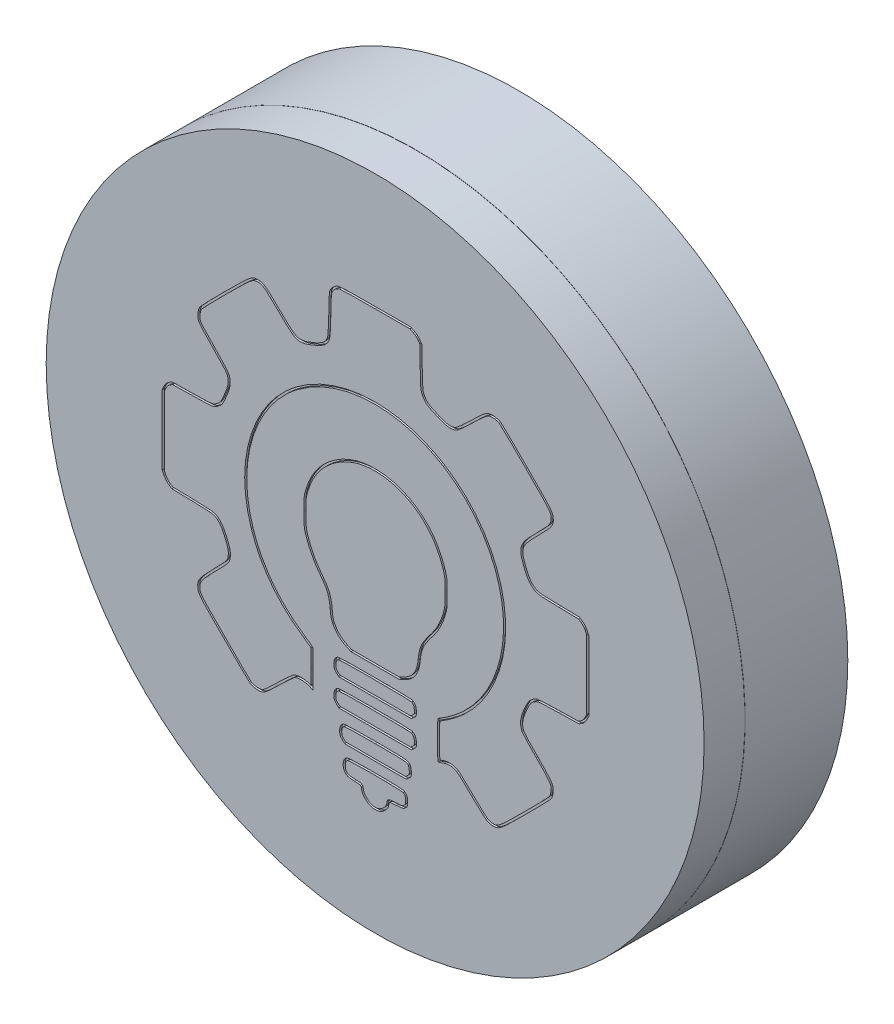
from build123d import *

# Parameters (mm, degrees)
SKETCH1_R           = 16.025
SKETCH1_R_2         = 15.025
BOSS_EXTRUDE1_DEPTH = 5
SKETCH2_R           = 16.025
BOSS_EXTRUDE3_DEPTH = 2
CUT_EXTRUDE1_DEPTH  = 0.1
SKETCH6_R           = 16.025
SKETCH6_R_2         = 16.015
CUT_EXTRUDE3_DEPTH  = 0.01


with BuildPart() as part:
    # Sketch1 → Boss-Extrude1 (new body)
    with BuildSketch(Plane.XY):
        Circle(SKETCH1_R)
        Circle(SKETCH1_R_2, mode=Mode.SUBTRACT)
    extrude(amount=BOSS_EXTRUDE1_DEPTH)

    # Sketch2 → Boss-Extrude3 (add)
    with BuildSketch(Plane.XY.offset(5)):
        Circle(SKETCH2_R)
    extrude(amount=BOSS_EXTRUDE3_DEPTH)

    # Sketch4 → Cut-Extrude1 (cut)
    # profile 1 of 6: a face of its own
    with BuildSketch(Plane.XY.offset(7)):
        with BuildLine():
            Line((-8.9288112, 2.310141401), (-9.9024785, 2.292502501))
            Line((-9.9024785, 2.292502501), (-10.0506452, 2.193724701))
            add(Edge.make_bspline(
                [(-10.0506452, 2.193724701), (-10.1529508, 2.123169101), (-10.2270342, 2.038502301), (-10.2870065, 1.911502301)],
                knots=[0, 0, 0, 0, 1, 1, 1, 1], degree=3))
            Line((-10.2870065, 1.911502301), (-10.3716732, 1.728057701))
            Line((-10.3716732, 1.728057701), (-10.3716732, 0.031195501))
            Line((-10.3716732, 0.031195501), (-10.3716732, -1.662138899))
            Line((-10.3716732, -1.662138899), (-10.2834787, -1.842055699))
            add(Edge.make_bspline(
                [(-10.2834787, -1.842055699), (-10.2270342, -1.954944599), (-10.1388397, -2.060777999), (-10.0471174, -2.120750299)],
                knots=[0, 0, 0, 0, 1, 1, 1, 1], degree=3))
            Line((-10.0471174, -2.120750299), (-9.9024785, -2.223055899))
            Line((-9.9024785, -2.223055899), (-8.9288112, -2.240694799))
            add(Edge.make_bspline(
                [(-8.9288112, -2.240694799), (-7.8281438, -2.261861499), (-7.792866, -2.268916999), (-7.5706159, -2.526444999)],
                knots=[0, 0, 0, 0, 1, 1, 1, 1], degree=3))
            add(Edge.make_bspline(
                [(-7.5706159, -2.526444999), (-7.4295047, -2.692250599), (-7.2107823, -3.172028699), (-7.1649212, -3.429556699)],
                knots=[0, 0, 0, 0, 1, 1, 1, 1], degree=3))
            add(Edge.make_bspline(
                [(-7.1649212, -3.429556699), (-7.1472823, -3.517751199), (-7.1508101, -3.651806799), (-7.168449, -3.750584599)],
                knots=[0, 0, 0, 0, 1, 1, 1, 1], degree=3))
            add(Edge.make_bspline(
                [(-7.168449, -3.750584599), (-7.2037268, -3.902279199), (-7.2566435, -3.969306999), (-7.8528383, -4.569029599)],
                knots=[0, 0, 0, 0, 1, 1, 1, 1], degree=3))
            add(Edge.make_bspline(
                [(-7.8528383, -4.569029599), (-8.5195887, -5.242835599), (-8.6395332, -5.412168999), (-8.643061, -5.659113599)],
                knots=[0, 0, 0, 0, 1, 1, 1, 1], degree=3))
            add(Edge.make_bspline(
                [(-8.643061, -5.659113599), (-8.643061, -5.980141599), (-8.6289499, -5.997780499), (-7.376588, -7.260725699)],
                knots=[0, 0, 0, 0, 1, 1, 1, 1], degree=3))
            add(Edge.make_bspline(
                [(-7.376588, -7.260725699), (-6.7239487, -7.916892799), (-6.141865, -8.484865399), (-6.0783649, -8.523670999)],
                knots=[0, 0, 0, 0, 1, 1, 1, 1], degree=3))
            add(Edge.make_bspline(
                [(-6.0783649, -8.523670999), (-5.9301982, -8.615393299), (-5.6550313, -8.647143299), (-5.4821701, -8.590698799)],
                knots=[0, 0, 0, 0, 1, 1, 1, 1], degree=3))
            add(Edge.make_bspline(
                [(-5.4821701, -8.590698799), (-5.3798645, -8.558948799), (-5.178781, -8.382559799), (-4.6919474, -7.902781699)],
                knots=[0, 0, 0, 0, 1, 1, 1, 1], degree=3))
            add(Edge.make_bspline(
                [(-4.6919474, -7.902781699), (-4.3321138, -7.550003699), (-3.9828636, -7.228975699), (-3.9158358, -7.193697899)],
                knots=[0, 0, 0, 0, 1, 1, 1, 1], degree=3))
            add(Edge.make_bspline(
                [(-3.9158358, -7.193697899), (-3.7429746, -7.101975599), (-3.414891, -7.109031199), (-3.1996965, -7.204281299)],
                knots=[0, 0, 0, 0, 1, 1, 1, 1], degree=3))
            Line((-3.1996965, -7.204281299), (-3.0338908, -7.281892399))
            Line((-3.0338908, -7.281892399), (-3.0338908, -6.399947399))
            add(Edge.make_bspline(
                [(-3.0338908, -6.399947399), (-3.0338908, -5.916641599), (-3.030363, -5.510946899), (-3.0268352, -5.493307999)],
                knots=[0, 0, 0, 0, 1, 1, 1, 1], degree=3))
            add(Edge.make_bspline(
                [(-3.0268352, -5.493307999), (-3.0268352, -5.479196799), (-3.206752, -5.345141199), (-3.4325299, -5.193446699)],
                knots=[0, 0, 0, 0, 1, 1, 1, 1], degree=3))
            add(Edge.make_bspline(
                [(-3.4325299, -5.193446699), (-4.6566696, -4.375001699), (-5.4892257, -3.288445499), (-5.9407815, -1.919666799)],
                knots=[0, 0, 0, 0, 1, 1, 1, 1], degree=3))
            add(Edge.make_bspline(
                [(-5.9407815, -1.919666799), (-6.7803932, 0.609751401), (-5.8984482, 3.431975401), (-3.7711968, 5.033587601)],
                knots=[0, 0, 0, 0, 1, 1, 1, 1], degree=3))
            add(Edge.make_bspline(
                [(-3.7711968, 5.033587601), (-1.6898066, 6.596394101), (1.1183063, 6.716338601), (3.3337521, 5.333448901)],
                knots=[0, 0, 0, 0, 1, 1, 1, 1], degree=3))
            add(Edge.make_bspline(
                [(3.3337521, 5.333448901), (5.7502814, 3.827086801), (6.8403654, 0.810834901), (5.9443093, -1.905555699)],
                knots=[0, 0, 0, 0, 1, 1, 1, 1], degree=3))
            add(Edge.make_bspline(
                [(5.9443093, -1.905555699), (5.5033368, -3.253167699), (4.649614, -4.378529499), (3.4713355, -5.168752199)],
                knots=[0, 0, 0, 0, 1, 1, 1, 1], degree=3))
            add(Edge.make_bspline(
                [(3.4713355, -5.168752199), (3.2737798, -5.299280099), (3.0973908, -5.412168999), (3.0726964, -5.419224599)],
                knots=[0, 0, 0, 0, 1, 1, 1, 1], degree=3))
            add(Edge.make_bspline(
                [(3.0726964, -5.419224599), (3.0091963, -5.440391299), (3.0127241, -7.271309099), (3.0762242, -7.260725699)],
                knots=[0, 0, 0, 0, 1, 1, 1, 1], degree=3))
            add(Edge.make_bspline(
                [(3.0762242, -7.260725699), (3.1009186, -7.257197999), (3.2173354, -7.218392399), (3.3337521, -7.179586799)],
                knots=[0, 0, 0, 0, 1, 1, 1, 1], degree=3))
            add(Edge.make_bspline(
                [(3.3337521, -7.179586799), (3.5630578, -7.094920099), (3.7711968, -7.105503399), (3.9687525, -7.204281299)],
                knots=[0, 0, 0, 0, 1, 1, 1, 1], degree=3))
            add(Edge.make_bspline(
                [(3.9687525, -7.204281299), (4.025197, -7.236031299), (4.3603361, -7.542948099), (4.7095863, -7.888670599)],
                knots=[0, 0, 0, 0, 1, 1, 1, 1], degree=3))
            add(Edge.make_bspline(
                [(4.7095863, -7.888670599), (5.3516423, -8.523670999), (5.4927535, -8.625976599), (5.7185314, -8.625976599)],
                knots=[0, 0, 0, 0, 1, 1, 1, 1], degree=3))
            add(Edge.make_bspline(
                [(5.7185314, -8.625976599), (6.0325038, -8.625976599), (6.0571983, -8.608337699), (7.3130879, -7.359503599)],
                knots=[0, 0, 0, 0, 1, 1, 1, 1], degree=3))
            add(Edge.make_bspline(
                [(7.3130879, -7.359503599), (7.969255, -6.706864299), (8.5372276, -6.124780599), (8.5760332, -6.061280499)],
                knots=[0, 0, 0, 0, 1, 1, 1, 1], degree=3))
            add(Edge.make_bspline(
                [(8.5760332, -6.061280499), (8.6148388, -6.001308299), (8.6536443, -5.870780399), (8.6677555, -5.772002599)],
                knots=[0, 0, 0, 0, 1, 1, 1, 1], degree=3))
            add(Edge.make_bspline(
                [(8.6677555, -5.772002599), (8.706561, -5.443918999), (8.6360054, -5.338085599), (7.9269217, -4.625474099)],
                knots=[0, 0, 0, 0, 1, 1, 1, 1], degree=3))
            add(Edge.make_bspline(
                [(7.9269217, -4.625474099), (7.552977, -4.251529399), (7.2707546, -3.937556999), (7.2390046, -3.867001399)],
                knots=[0, 0, 0, 0, 1, 1, 1, 1], degree=3))
            add(Edge.make_bspline(
                [(7.2390046, -3.867001399), (7.1472823, -3.648278999), (7.1719767, -3.422501099), (7.3201435, -3.052084199)],
                knots=[0, 0, 0, 0, 1, 1, 1, 1], degree=3))
            add(Edge.make_bspline(
                [(7.3201435, -3.052084199), (7.5176992, -2.565250599), (7.6235326, -2.427667099), (7.9022272, -2.304194799)],
                knots=[0, 0, 0, 0, 1, 1, 1, 1], degree=3))
            add(Edge.make_bspline(
                [(7.9022272, -2.304194799), (7.9551439, -2.279500399), (8.3643664, -2.254805899), (8.964089, -2.244222599)],
                knots=[0, 0, 0, 0, 1, 1, 1, 1], degree=3))
            Line((8.964089, -2.244222599), (9.9377563, -2.223055899))
            Line((9.9377563, -2.223055899), (10.0788675, -2.127805799))
            add(Edge.make_bspline(
                [(10.0788675, -2.127805799), (10.1705897, -2.067833599), (10.2552565, -1.969055699), (10.3152287, -1.849111199)],
                knots=[0, 0, 0, 0, 1, 1, 1, 1], degree=3))
            Line((10.3152287, -1.849111199), (10.406951, -1.662138899))
            Line((10.406951, -1.662138899), (10.406951, 0.031195501))
            Line((10.406951, 0.031195501), (10.406951, 1.728057701))
            Line((10.406951, 1.728057701), (10.3222843, 1.911502301))
            add(Edge.make_bspline(
                [(10.3222843, 1.911502301), (10.262312, 2.038502301), (10.1882286, 2.123169101), (10.085923, 2.193724701)],
                knots=[0, 0, 0, 0, 1, 1, 1, 1], degree=3))
            Line((10.085923, 2.193724701), (9.9377563, 2.292502501))
            Line((9.9377563, 2.292502501), (8.964089, 2.310141401))
            add(Edge.make_bspline(
                [(8.964089, 2.310141401), (8.0468662, 2.327780301), (7.9833661, 2.334835901), (7.8422549, 2.405391501)],
                knots=[0, 0, 0, 0, 1, 1, 1, 1], degree=3))
            add(Edge.make_bspline(
                [(7.8422549, 2.405391501), (7.6305881, 2.518280401), (7.5071158, 2.691141601), (7.3413102, 3.103891901)],
                knots=[0, 0, 0, 0, 1, 1, 1, 1], degree=3))
            add(Edge.make_bspline(
                [(7.3413102, 3.103891901), (7.0696711, 3.788281201), (7.1155323, 3.915281301), (7.9551439, 4.744309601)],
                knots=[0, 0, 0, 0, 1, 1, 1, 1], degree=3))
            add(Edge.make_bspline(
                [(7.9551439, 4.744309601), (8.5583943, 5.340504401), (8.674811, 5.499254501), (8.6783388, 5.728560201)],
                knots=[0, 0, 0, 0, 1, 1, 1, 1], degree=3))
            add(Edge.make_bspline(
                [(8.6783388, 5.728560201), (8.6783388, 6.049588201), (8.6642277, 6.067227101), (7.4118658, 7.330172301)],
                knots=[0, 0, 0, 0, 1, 1, 1, 1], degree=3))
            add(Edge.make_bspline(
                [(7.4118658, 7.330172301), (6.7592265, 7.986339401), (6.1771428, 8.554312001), (6.1136427, 8.593117601)],
                knots=[0, 0, 0, 0, 1, 1, 1, 1], degree=3))
            add(Edge.make_bspline(
                [(6.1136427, 8.593117601), (6.0536705, 8.631923201), (5.9231426, 8.670728701), (5.8243648, 8.684839901)],
                knots=[0, 0, 0, 0, 1, 1, 1, 1], degree=3))
            add(Edge.make_bspline(
                [(5.8243648, 8.684839901), (5.4962812, 8.723645401), (5.3833923, 8.653089801), (4.6743085, 7.951061601)],
                knots=[0, 0, 0, 0, 1, 1, 1, 1], degree=3))
            add(Edge.make_bspline(
                [(4.6743085, 7.951061601), (4.2862527, 7.570061401), (3.9863914, 7.301950101), (3.9052525, 7.266672301)],
                knots=[0, 0, 0, 0, 1, 1, 1, 1], degree=3))
            add(Edge.make_bspline(
                [(3.9052525, 7.266672301), (3.6900579, 7.178477801), (3.5101411, 7.199644501), (3.0903353, 7.372505701)],
                knots=[0, 0, 0, 0, 1, 1, 1, 1], degree=3))
            add(Edge.make_bspline(
                [(3.0903353, 7.372505701), (2.6281961, 7.563005801), (2.501196, 7.651200301), (2.3953626, 7.873450501)],
                knots=[0, 0, 0, 0, 1, 1, 1, 1], degree=3))
            add(Edge.make_bspline(
                [(2.3953626, 7.873450501), (2.3142237, 8.035728301), (2.3106959, 8.085117301), (2.293057, 8.998812301)],
                knots=[0, 0, 0, 0, 1, 1, 1, 1], degree=3))
            Line((2.293057, 8.998812301), (2.2754181, 9.954840701))
            Line((2.2754181, 9.954840701), (2.180168, 10.095951901))
            add(Edge.make_bspline(
                [(2.180168, 10.095951901), (2.1201958, 10.187674101), (2.0214179, 10.272340901), (1.9014734, 10.332313101)],
                knots=[0, 0, 0, 0, 1, 1, 1, 1], degree=3))
            Line((1.9014734, 10.332313101), (1.7145011, 10.424035401))
            Line((1.7145011, 10.424035401), (0.0211667, 10.420507601))
            add(Edge.make_bspline(
                [(0.0211667, 10.420507601), (-1.0830285, 10.420507601), (-1.7145011, 10.406396501), (-1.7815289, 10.381702001)],
                knots=[0, 0, 0, 0, 1, 1, 1, 1], degree=3))
            add(Edge.make_bspline(
                [(-1.7815289, 10.381702001), (-1.9438068, 10.321729801), (-2.0672791, 10.222951901), (-2.1590014, 10.078313001)],
                knots=[0, 0, 0, 0, 1, 1, 1, 1], degree=3))
            add(Edge.make_bspline(
                [(-2.1590014, 10.078313001), (-2.2366125, 9.951312901), (-2.2401403, 9.912507301), (-2.2577792, 8.995284501)],
                knots=[0, 0, 0, 0, 1, 1, 1, 1], degree=3))
            add(Edge.make_bspline(
                [(-2.2577792, 8.995284501), (-2.2789459, 7.944006101), (-2.2895292, 7.891089401), (-2.5117794, 7.668839201)],
                knots=[0, 0, 0, 0, 1, 1, 1, 1], degree=3))
            add(Edge.make_bspline(
                [(-2.5117794, 7.668839201), (-2.6564183, 7.520672501), (-3.287891, 7.249033401), (-3.5383633, 7.220811201)],
                knots=[0, 0, 0, 0, 1, 1, 1, 1], degree=3))
            add(Edge.make_bspline(
                [(-3.5383633, 7.220811201), (-3.848808, 7.189061101), (-3.9581692, 7.263144501), (-4.6425585, 7.944006101)],
                knots=[0, 0, 0, 0, 1, 1, 1, 1], degree=3))
            add(Edge.make_bspline(
                [(-4.6425585, 7.944006101), (-5.2810867, 8.579006501), (-5.4398368, 8.691895401), (-5.6797258, 8.695423201)],
                knots=[0, 0, 0, 0, 1, 1, 1, 1], degree=3))
            add(Edge.make_bspline(
                [(-5.6797258, 8.695423201), (-6.0042816, 8.695423201), (-6.0148649, 8.688367601), (-7.2778101, 7.432478001)],
                knots=[0, 0, 0, 0, 1, 1, 1, 1], degree=3))
            add(Edge.make_bspline(
                [(-7.2778101, 7.432478001), (-7.9339772, 6.776310901), (-8.5019498, 6.194227201), (-8.5407554, 6.130727101)],
                knots=[0, 0, 0, 0, 1, 1, 1, 1], degree=3))
            add(Edge.make_bspline(
                [(-8.5407554, 6.130727101), (-8.6324777, 5.982560401), (-8.6642277, 5.707393501), (-8.6077832, 5.534532301)],
                knots=[0, 0, 0, 0, 1, 1, 1, 1], degree=3))
            add(Edge.make_bspline(
                [(-8.6077832, 5.534532301), (-8.5725054, 5.432226701), (-8.3925886, 5.224087701), (-7.8986994, 4.723142901)],
                knots=[0, 0, 0, 0, 1, 1, 1, 1], degree=3))
            add(Edge.make_bspline(
                [(-7.8986994, 4.723142901), (-7.1966712, 4.010531401), (-7.1613934, 3.957614701), (-7.1613934, 3.626003301)],
                knots=[0, 0, 0, 0, 1, 1, 1, 1], degree=3))
            add(Edge.make_bspline(
                [(-7.1613934, 3.626003301), (-7.1613934, 3.435503201), (-7.4189213, 2.782863901), (-7.5565048, 2.610002701)],
                knots=[0, 0, 0, 0, 1, 1, 1, 1], degree=3))
            add(Edge.make_bspline(
                [(-7.5565048, 2.610002701), (-7.616477, 2.542974901), (-7.729366, 2.447724801), (-7.8069771, 2.405391501)],
                knots=[0, 0, 0, 0, 1, 1, 1, 1], degree=3))
            add(Edge.make_bspline(
                [(-7.8069771, 2.405391501), (-7.9480883, 2.334835901), (-8.0115884, 2.327780301), (-8.9288112, 2.310141401)],
                knots=[0, 0, 0, 0, 1, 1, 1, 1], degree=3))
        make_face()
        with BuildLine():
            Line((-8.926999902, 2.210157744), (-9.871380494, 2.193049462))
            Line((-9.871380494, 2.193049462), (-9.994499236, 2.110970301))
            add(Edge.make_bspline(
                [(-9.994499236, 2.110970301), (-10.015972402, 2.096128416), (-10.058129542, 2.063359706), (-10.109608985, 2.010305558), (-10.154972216, 1.948920007), (-10.184115388, 1.895200747), (-10.196581657, 1.868801625)],
                knots=[0.002322855, 0.002322855, 0.002322855, 0.002322855, 0.251742141, 0.501161428, 0.750580714, 1, 1, 1, 1], degree=3))
            Line((-10.196581657, 1.868801625), (-10.2716732, 1.706094025))
            Line((-10.2716732, 1.706094025), (-10.2716732, 0.031195501))
            Line((-10.2716732, 0.031195501), (-10.2716732, -1.638947353))
            Line((-10.2716732, -1.638947353), (-10.194035997, -1.797334308))
            add(Edge.make_bspline(
                [(-10.194035997, -1.797334308), (-10.18150014, -1.822406), (-10.153346231, -1.870863391), (-10.102472256, -1.939044575), (-10.045879437, -1.997625998), (-10.010525725, -2.02519697), (-9.990862899, -2.038053438)],
                knots=[0, 0, 0, 0, 0.251389654, 0.502779308, 0.754168962, 1.005558616, 1.005558616, 1.005558616, 1.005558616], degree=3))
            Line((-9.990862899, -2.038053438), (-9.869875205, -2.123630131))
            Line((-9.869875205, -2.123630131), (-8.926999941, -2.140711142))
            add(Edge.make_bspline(
                [(-8.926999941, -2.140711142), (-8.862180746, -2.141957666), (-8.726909995, -2.144608165), (-8.501448284, -2.149717566), (-8.267017407, -2.157315144), (-8.055495061, -2.171596562), (-7.840447676, -2.202019618), (-7.652009029, -2.280468647), (-7.546256444, -2.40161365), (-7.494685221, -2.461370806)],
                knots=[-3.3757e-05, -3.3757e-05, -3.3757e-05, -3.3757e-05, 0.062489449, 0.125012655, 0.250059066, 0.375105477, 0.500151889, 0.750244711, 1.000337534, 1.000337534, 1.000337534, 1.000337534], degree=3))
            add(Edge.make_bspline(
                [(-7.494685221, -2.461370806), (-7.471782984, -2.488280924), (-7.432614325, -2.542212679), (-7.345707626, -2.684567473), (-7.238650158, -2.897169549), (-7.126186895, -3.178571763), (-7.081413169, -3.328672852), (-7.066651646, -3.411008399)],
                knots=[-0.000527359, -0.000527359, -0.000527359, -0.000527359, 0.124392901, 0.249313161, 0.499153681, 0.748994201, 0.998834721, 0.998834721, 0.998834721, 0.998834721], degree=3))
            add(Edge.make_bspline(
                [(-7.066651646, -3.411008399), (-7.061005167, -3.439556125), (-7.05438461, -3.496209784), (-7.052257588, -3.589646962), (-7.057609528, -3.684324327), (-7.065267769, -3.741628224), (-7.070461535, -3.770713298)],
                knots=[0.003225677, 0.003225677, 0.003225677, 0.003225677, 0.254570237, 0.505914798, 0.757259358, 1.008603918, 1.008603918, 1.008603918, 1.008603918], degree=3))
            add(Edge.make_bspline(
                [(-7.070461535, -3.770713298), (-7.080965153, -3.815878874), (-7.106104641, -3.898585742), (-7.189632632, -4.018930581), (-7.302911509, -4.1476857), (-7.419174728, -4.271182276), (-7.548703064, -4.403992639), (-7.672683008, -4.52953956), (-7.746399011, -4.603800796), (-7.781837728, -4.639449286)],
                knots=[-0.005543247, -0.005543247, -0.005543247, -0.005543247, 0.245831167, 0.497205581, 0.622892788, 0.748579995, 0.874267202, 0.937110805, 0.999954408, 0.999954408, 0.999954408, 0.999954408], degree=3))
            add(Edge.make_bspline(
                [(-7.781837728, -4.639449286), (-7.821337599, -4.679367379), (-7.903003322, -4.762272485), (-8.04261815, -4.905889187), (-8.190355549, -5.062214834), (-8.3242641, -5.213606398), (-8.453098972, -5.377541834), (-8.529965401, -5.518028757), (-8.542300438, -5.610169362), (-8.543060974, -5.659850768)],
                knots=[4.0741e-05, 4.0741e-05, 4.0741e-05, 4.0741e-05, 0.062471231, 0.124901721, 0.249762701, 0.374623681, 0.499484661, 0.74920662, 0.99892858, 0.99892858, 0.99892858, 0.99892858], degree=3))
            add(Edge.make_bspline(
                [(-8.543060974, -5.659850768), (-8.543058616, -5.693372824), (-8.542206954, -5.767766431), (-8.529618183, -5.835035996), (-8.493945196, -5.917625312), (-8.411132744, -6.036708128), (-8.2655905, -6.206190372), (-8.045548764, -6.439835629), (-7.786403657, -6.704628735), (-7.532702631, -6.961244907), (-7.37911461, -7.116157566), (-7.305633679, -7.190259466)],
                knots=[0.000773296, 0.000773296, 0.000773296, 0.000773296, 0.125674862, 0.250576429, 0.375477995, 0.500379561, 0.625281128, 0.750182694, 0.87508426, 0.937535043, 0.999985827, 0.999985827, 0.999985827, 0.999985827], degree=3))
            add(Edge.make_bspline(
                [(-7.305633679, -7.190259466), (-7.153358611, -7.343357428), (-6.833346307, -7.66304909), (-6.503294922, -7.98785416), (-6.287950314, -8.196541318), (-6.157452131, -8.320750542), (-6.080359922, -8.392111839), (-6.036993208, -8.429696395), (-6.030525658, -8.435099243), (-6.025067512, -8.439053011)],
                knots=[2.7251e-05, 2.7251e-05, 2.7251e-05, 2.7251e-05, 0.244110931, 0.488194611, 0.610236451, 0.732278291, 0.854320131, 0.915341051, 0.976361971, 0.976361971, 0.976361971, 0.976361971], degree=3))
            add(Edge.make_bspline(
                [(-6.025067512, -8.439053011), (-5.991683575, -8.459594711), (-5.924688121, -8.487023434), (-5.777987246, -8.518332878), (-5.627062216, -8.520611861), (-5.551398416, -8.508107856), (-5.512511789, -8.495410175)],
                knots=[0.002002929, 0.002002929, 0.002002929, 0.002002929, 0.251838933, 0.501674936, 0.75151094, 1.001346943, 1.001346943, 1.001346943, 1.001346943], degree=3))
            add(Edge.make_bspline(
                [(-5.512511789, -8.495410175), (-5.503630428, -8.492653892), (-5.49204372, -8.487619639), (-5.428649131, -8.449277602), (-5.311258827, -8.355216002), (-5.126465278, -8.185462959), (-4.937693821, -8.003880128), (-4.818337078, -7.886939346), (-4.762047425, -7.831465478)],
                knots=[-0.002286545, -0.002286545, -0.002286545, -0.002286545, 0.123007203, 0.248300951, 0.498888447, 0.749475942, 0.87476969, 1.000063438, 1.000063438, 1.000063438, 1.000063438], degree=3))
            add(Edge.make_bspline(
                [(-4.762047425, -7.831465478), (-4.674457025, -7.745592547), (-4.491274922, -7.568656822), (-4.253074706, -7.346142939), (-4.098187271, -7.207928456), (-4.011645422, -7.137525983), (-3.981196982, -7.115120833), (-3.962582295, -7.10529665)],
                knots=[-8.6047e-05, -8.6047e-05, -8.6047e-05, -8.6047e-05, 0.249846695, 0.499779438, 0.749712181, 0.874678553, 0.999644924, 0.999644924, 0.999644924, 0.999644924], degree=3))
            add(Edge.make_bspline(
                [(-3.962582295, -7.10529665), (-3.905649892, -7.075110111), (-3.783711985, -7.038283863), (-3.572289683, -7.022363401), (-3.354529846, -7.045671956), (-3.221872837, -7.085107619), (-3.158257536, -7.113265234)],
                knots=[0.000188654, 0.000188654, 0.000188654, 0.000188654, 0.250514884, 0.500841113, 0.751167343, 1.001493572, 1.001493572, 1.001493572, 1.001493572], degree=3))
            Line((-3.158257536, -7.113265234), (-3.1338908, -7.124670929))
            Line((-3.1338908, -7.124670929), (-3.1338908, -6.399947399))
            add(Edge.make_bspline(
                [(-3.1338908, -6.399947399), (-3.1338908, -6.304236749), (-3.133591496, -6.104893166), (-3.132412713, -5.853413341), (-3.131022816, -5.686465295), (-3.129655456, -5.584486603), (-3.129069249, -5.552127339), (-3.128626826, -5.533621886)],
                knots=[0, 0, 0, 0, 0.206566596, 0.413133192, 0.619699788, 0.722983086, 0.826266384, 0.826266384, 0.826266384, 0.826266384], degree=3))
            add(Edge.make_bspline(
                [(-3.128626826, -5.533621886), (-3.147794136, -5.518036027), (-3.181037784, -5.492491351), (-3.267984486, -5.428646206), (-3.369180851, -5.357359427), (-3.449407195, -5.302582623), (-3.488205268, -5.27651454)],
                knots=[0.277509677, 0.277509677, 0.277509677, 0.277509677, 0.458097373, 0.638685068, 0.819272763, 0.999860458, 0.999860458, 0.999860458, 0.999860458], degree=3))
            add(Edge.make_bspline(
                [(-3.488205268, -5.27651454), (-3.790377758, -5.074479003), (-4.373472623, -4.61768117), (-5.079590788, -3.841014661), (-5.642722086, -2.960719832), (-5.923656624, -2.290755599), (-6.035718464, -1.951083056)],
                knots=[2.5476e-05, 2.5476e-05, 2.5476e-05, 2.5476e-05, 0.250013865, 0.500002254, 0.749990643, 0.999979032, 0.999979032, 0.999979032, 0.999979032], degree=3))
            add(Edge.make_bspline(
                [(-6.035718464, -1.951083056), (-6.141114012, -1.63355234), (-6.301568888, -0.976155378), (-6.406742596, 0.338049877), (-6.158565084, 1.96433807), (-5.437548547, 3.442728464), (-4.603842801, 4.463346741), (-4.098379694, 4.912425234), (-3.831292648, 5.113515652)],
                knots=[1.133e-05, 1.133e-05, 1.133e-05, 1.133e-05, 0.125010941, 0.250010551, 0.500009773, 0.750008995, 0.875008605, 1.000008216, 1.000008216, 1.000008216, 1.000008216], degree=3))
            add(Edge.make_bspline(
                [(-3.831292648, 5.113515652), (-3.570453606, 5.309365978), (-3.013866092, 5.664186454), (-1.841426533, 6.180421468), (-0.277544967, 6.482033843), (1.307709023, 6.313791097), (2.522389493, 5.898355393), (3.109162864, 5.591519146), (3.386677585, 5.418295196)],
                knots=[-8.405e-06, -8.405e-06, -8.405e-06, -8.405e-06, 0.124992167, 0.249992739, 0.499993884, 0.749995028, 0.874995601, 0.999996173, 0.999996173, 0.999996173, 0.999996173], degree=3))
            add(Edge.make_bspline(
                [(3.386677585, 5.418295196), (3.689537216, 5.229503264), (4.267420724, 4.795067968), (5.229099114, 3.772454906), (6.080963031, 2.240281635), (6.404506838, 0.515150429), (6.318402249, -0.889961918), (6.151543921, -1.596520369), (6.039313235, -1.936768941)],
                knots=[3.509e-06, 3.509e-06, 3.509e-06, 3.509e-06, 0.125001358, 0.249999208, 0.499994908, 0.749990608, 0.874988458, 0.999986308, 0.999986308, 0.999986308, 0.999986308], degree=3))
            add(Edge.make_bspline(
                [(6.039313235, -1.936768941), (5.928816048, -2.274427809), (5.650457274, -2.937051287), (5.086979503, -3.824246415), (4.384820383, -4.606557464), (3.821946552, -5.054018793), (3.526748694, -5.251995797)],
                knots=[2.7633e-05, 2.7633e-05, 2.7633e-05, 2.7633e-05, 0.250040962, 0.500054291, 0.75006762, 1.00008095, 1.00008095, 1.00008095, 1.00008095], degree=3))
            add(Edge.make_bspline(
                [(3.526748694, -5.251995797), (3.488383836, -5.277344013), (3.408869381, -5.329576632), (3.305059726, -5.396816361), (3.2142094, -5.454124321), (3.17678663, -5.476932261), (3.154763423, -5.489547854)],
                knots=[-0.000485027, -0.000485027, -0.000485027, -0.000485027, 0.199236321, 0.39895767, 0.598679018, 0.798400367, 0.798400367, 0.798400367, 0.798400367], degree=3))
            add(Edge.make_bspline(
                [(3.154763423, -5.489547854), (3.152242452, -5.506750568), (3.148932279, -5.53662281), (3.141166481, -5.634296239), (3.134010227, -5.790033643), (3.128458228, -6.019776912), (3.126297176, -6.271745262), (3.127401209, -6.528469356), (3.131803734, -6.772368853), (3.138023184, -6.948341982), (3.144787226, -7.066911196), (3.148157662, -7.110955695), (3.150388122, -7.134836326)],
                knots=[0.098871727, 0.098871727, 0.098871727, 0.098871727, 0.145400216, 0.191928704, 0.284985681, 0.378042658, 0.471099635, 0.564156612, 0.657213589, 0.750270566, 0.796799054, 0.843327543, 0.843327543, 0.843327543, 0.843327543], degree=3))
            add(Edge.make_bspline(
                [(3.150388122, -7.134836326), (3.161865191, -7.131130324), (3.184084019, -7.123887792), (3.221658781, -7.111497281), (3.260573651, -7.098569601), (3.287360116, -7.089641533), (3.300646765, -7.085212656)],
                knots=[0.53687387, 0.53687387, 0.53687387, 0.53687387, 0.651594126, 0.766314383, 0.88103464, 0.995754896, 0.995754896, 0.995754896, 0.995754896], degree=3))
            add(Edge.make_bspline(
                [(3.300646765, -7.085212656), (3.360998873, -7.063022753), (3.488502442, -7.028087087), (3.670096116, -7.016906693), (3.84749467, -7.044196716), (3.96160335, -7.088903312), (4.015654083, -7.115928693)],
                knots=[0.002040543, 0.002040543, 0.002040543, 0.002040543, 0.252450065, 0.502859588, 0.753269111, 1.003678634, 1.003678634, 1.003678634, 1.003678634], degree=3))
            add(Edge.make_bspline(
                [(4.015654083, -7.115928693), (4.031419609, -7.124796792), (4.056636489, -7.143240802), (4.136015346, -7.208927272), (4.282915591, -7.340754834), (4.513898989, -7.557432241), (4.694163701, -7.73269503), (4.779921165, -7.817586091)],
                knots=[-0.012546272, -0.012546272, -0.012546272, -0.012546272, 0.114020115, 0.240586502, 0.493719276, 0.74685205, 0.999984824, 0.999984824, 0.999984824, 0.999984824], degree=3))
            add(Edge.make_bspline(
                [(4.779921165, -7.817586091), (4.8179526, -7.85519956), (4.897000051, -7.933087247), (5.033102003, -8.065668029), (5.180195467, -8.205344878), (5.320827715, -8.330798762), (5.471039376, -8.449920884), (5.593469652, -8.516990739), (5.674951397, -8.525976599), (5.7185314, -8.525976599)],
                knots=[8.288e-06, 8.288e-06, 8.288e-06, 8.288e-06, 0.06250777, 0.125007252, 0.250006216, 0.37500518, 0.500004144, 0.750002072, 1, 1, 1, 1], degree=3))
            add(Edge.make_bspline(
                [(5.7185314, -8.525976599), (5.751337275, -8.525976599), (5.824037622, -8.5250464), (5.890315546, -8.512362873), (5.9728663, -8.476337166), (6.09207196, -8.393123137), (6.261570955, -8.247374945), (6.494927106, -8.027362034), (6.758983798, -7.76850994), (7.014623973, -7.515211986), (7.16881259, -7.361943712), (7.242572378, -7.288598302)],
                knots=[0, 0, 0, 0, 0.124999857, 0.249999714, 0.374999571, 0.499999428, 0.624999286, 0.749999143, 0.874999, 0.937498928, 0.999998857, 0.999998857, 0.999998857, 0.999998857], degree=3))
            add(Edge.make_bspline(
                [(7.242572378, -7.288598302), (7.395583599, -7.136409709), (7.715079676, -6.816594784), (8.039759547, -6.486676743), (8.24843514, -6.271352143), (8.372689822, -6.140817897), (8.444152836, -6.063626181), (8.481846416, -6.020164602), (8.487369235, -6.013552245), (8.491377405, -6.008035225)],
                knots=[2.189e-06, 2.189e-06, 2.189e-06, 2.189e-06, 0.243935921, 0.487869654, 0.60983652, 0.731803386, 0.853770253, 0.914753686, 0.975737119, 0.975737119, 0.975737119, 0.975737119], degree=3))
            add(Edge.make_bspline(
                [(8.491377405, -6.008035225), (8.499654697, -5.995243066), (8.510410303, -5.973277788), (8.53612486, -5.90413706), (8.556275893, -5.82817505), (8.565170163, -5.782684144), (8.568593327, -5.759027906)],
                knots=[-0.006009844, -0.006009844, -0.006009844, -0.006009844, 0.244357075, 0.494723995, 0.745090914, 0.995457833, 0.995457833, 0.995457833, 0.995457833], degree=3))
            add(Edge.make_bspline(
                [(8.568593327, -5.759027906), (8.572622929, -5.724765193), (8.578781696, -5.650184188), (8.570154894, -5.546017237), (8.528894726, -5.440616005), (8.412465779, -5.282729395), (8.281626003, -5.133128474), (8.130536194, -4.974346642), (7.984725843, -4.825610123), (7.897912178, -4.738091816), (7.856123969, -4.696095535)],
                knots=[0.001314798, 0.001314798, 0.001314798, 0.001314798, 0.126145306, 0.250975815, 0.500636831, 0.62546734, 0.750297848, 0.875128356, 0.93754361, 0.999958864, 0.999958864, 0.999958864, 0.999958864], degree=3))
            add(Edge.make_bspline(
                [(7.856123969, -4.696095535), (7.767301622, -4.607272012), (7.581499598, -4.417203194), (7.368813319, -4.189738437), (7.213713223, -4.007406493), (7.166662948, -3.949924687), (7.147284399, -3.906861218)],
                knots=[7.7923e-05, 7.7923e-05, 7.7923e-05, 7.7923e-05, 0.251446555, 0.502815186, 0.754183817, 1.005552449, 1.005552449, 1.005552449, 1.005552449], degree=3))
            add(Edge.make_bspline(
                [(7.147284399, -3.906861218), (7.121555618, -3.845507971), (7.084334895, -3.717358761), (7.082370374, -3.509231761), (7.12653937, -3.287732914), (7.192882296, -3.100979662), (7.22738928, -3.014712227)],
                knots=[-0.001811289, -0.001811289, -0.001811289, -0.001811289, 0.248693623, 0.499198534, 0.749703446, 1.000208358, 1.000208358, 1.000208358, 1.000208358], degree=3))
            add(Edge.make_bspline(
                [(7.22738928, -3.014712227), (7.250455933, -2.957869413), (7.300466503, -2.838499521), (7.387519065, -2.652698132), (7.49742037, -2.469751101), (7.654041328, -2.316774854), (7.79174434, -2.243798702), (7.861107562, -2.213036802)],
                knots=[-0.000158215, -0.000158215, -0.000158215, -0.000158215, 0.124774888, 0.24970799, 0.499574195, 0.7494404, 0.999306605, 0.999306605, 0.999306605, 0.999306605], degree=3))
            add(Edge.make_bspline(
                [(7.861107562, -2.213036802), (7.902929057, -2.194003088), (7.976252606, -2.188371322), (8.206825695, -2.167905757), (8.481273236, -2.156460687), (8.741343494, -2.14866856), (8.889933138, -2.145515267), (8.961916414, -2.144244028)],
                knots=[0.001884785, 0.001884785, 0.001884785, 0.001884785, 0.251356938, 0.50082909, 0.750301242, 0.875037318, 0.999773395, 0.999773395, 0.999773395, 0.999773395], degree=3))
            Line((8.961916414, -2.144244028), (9.906183732, -2.123717293))
            Line((9.906183732, -2.123717293), (10.023529234, -2.044509045))
            add(Edge.make_bspline(
                [(10.023529234, -2.044509045), (10.043031357, -2.031757659), (10.078620215, -2.004257704), (10.133384191, -1.948128839), (10.18312424, -1.881829864), (10.212777031, -1.830408064), (10.225786796, -1.804388511)],
                knots=[-0.002231974, -0.002231974, -0.002231974, -0.002231974, 0.248326019, 0.498884013, 0.749442006, 1, 1, 1, 1], degree=3))
            Line((10.225786796, -1.804388511), (10.30695183, -1.638930268))
            Line((10.30695183, -1.638930268), (10.30695183, 0.03119686))
            Line((10.30695183, 0.03119686), (10.30695183, 1.706095384))
            Line((10.30695183, 1.706095384), (10.231860816, 1.868800794))
            add(Edge.make_bspline(
                [(10.231860816, 1.868800794), (10.219394547, 1.895199916), (10.190251375, 1.948919177), (10.144888144, 2.010304727), (10.093408701, 2.063358876), (10.051251561, 2.096127586), (10.029778395, 2.110969471)],
                knots=[0, 0, 0, 0, 0.249419286, 0.498838572, 0.748257859, 0.997677145, 0.997677145, 0.997677145, 0.997677145], degree=3))
            Line((10.029778395, 2.110969471), (9.906659653, 2.193048632))
            Line((9.906659653, 2.193048632), (8.962167637, 2.210159056))
            add(Edge.make_bspline(
                [(8.962167637, 2.210159056), (8.907919362, 2.211202292), (8.794840075, 2.213422646), (8.605356263, 2.217453257), (8.40759351, 2.222495829), (8.229424598, 2.229330347), (8.052820354, 2.240693812), (7.911145017, 2.263162124), (7.83627852, 2.296576141), (7.796358235, 2.316536283)],
                knots=[0, 0, 0, 0, 0.06267372, 0.12534744, 0.25069488, 0.37604232, 0.50138976, 0.75208464, 1.00277952, 1.00277952, 1.00277952, 1.00277952], degree=3))
            add(Edge.make_bspline(
                [(7.796358235, 2.316536283), (7.738122513, 2.347595318), (7.628285546, 2.421001755), (7.491022386, 2.574477941), (7.390184343, 2.746707503), (7.311201179, 2.91483771), (7.268300671, 3.017370766), (7.248441491, 3.06680747)],
                knots=[-0.001827999, -0.001827999, -0.001827999, -0.001827999, 0.248667796, 0.499163591, 0.749659387, 0.874907284, 1.000155182, 1.000155182, 1.000155182, 1.000155182], degree=3))
            add(Edge.make_bspline(
                [(7.248441491, 3.06680747), (7.21713713, 3.145678184), (7.153321713, 3.314020055), (7.099278728, 3.516120667), (7.085655595, 3.71343309), (7.128423122, 3.905289966), (7.227417852, 4.09392417), (7.380359054, 4.293722007), (7.558712646, 4.487352456), (7.731805973, 4.663677979), (7.835045363, 4.766255545), (7.884868083, 4.815450312)],
                knots=[-9.3744e-05, -9.3744e-05, -9.3744e-05, -9.3744e-05, 0.124917163, 0.24992807, 0.374938976, 0.499949883, 0.62496079, 0.749971697, 0.874982604, 0.937488057, 0.99999351, 0.99999351, 0.99999351, 0.99999351], degree=3))
            add(Edge.make_bspline(
                [(7.884868083, 4.815450312), (7.952901966, 4.882688562), (8.098080092, 5.027524754), (8.254266145, 5.189581943), (8.377672628, 5.326255228), (8.495098473, 5.473221092), (8.565939025, 5.600533128), (8.577588918, 5.684213787), (8.578340129, 5.72935681)],
                knots=[9.054e-06, 9.054e-06, 9.054e-06, 9.054e-06, 0.12485043, 0.249691806, 0.374533181, 0.499374557, 0.749057309, 0.99874006, 0.99874006, 0.99874006, 0.99874006], degree=3))
            add(Edge.make_bspline(
                [(8.578340129, 5.72935681), (8.578337571, 5.762871314), (8.577483074, 5.837246296), (8.564889141, 5.904508479), (8.529205679, 5.987103033), (8.446382155, 6.106190957), (8.300833728, 6.275675326), (8.08079274, 6.509317649), (7.821656433, 6.774101251), (7.567967887, 7.030704702), (7.414389406, 7.185607736), (7.340912838, 7.259705237)],
                knots=[0.000836593, 0.000836593, 0.000836593, 0.000836593, 0.125730247, 0.250623901, 0.375517556, 0.50041121, 0.625304864, 0.750198518, 0.875092172, 0.937538999, 0.999985827, 0.999985827, 0.999985827, 0.999985827], degree=3))
            add(Edge.make_bspline(
                [(7.340912838, 7.259705237), (7.188729453, 7.41271102), (6.868924948, 7.732196319), (6.539020317, 8.056862634), (6.323704665, 8.265529304), (6.193175972, 8.389778524), (6.115987507, 8.4612384), (6.072527705, 8.498930362), (6.065915585, 8.504452964), (6.060398785, 8.508460976)],
                knots=[2.7251e-05, 2.7251e-05, 2.7251e-05, 2.7251e-05, 0.243954718, 0.487882185, 0.609845919, 0.731809652, 0.853773386, 0.914755252, 0.975737119, 0.975737119, 0.975737119, 0.975737119], degree=3))
            add(Edge.make_bspline(
                [(6.060398785, 8.508460976), (6.047606636, 8.516738261), (6.025641376, 8.52749386), (5.956500707, 8.553208401), (5.880538753, 8.573359429), (5.835047854, 8.582253706), (5.811391624, 8.585676874)],
                knots=[-0.006009844, -0.006009844, -0.006009844, -0.006009844, 0.244356922, 0.494723688, 0.745090454, 0.995457221, 0.995457221, 0.995457221, 0.995457221], degree=3))
            add(Edge.make_bspline(
                [(5.811391624, 8.585676874), (5.777014243, 8.589719727), (5.702394524, 8.595868235), (5.596608015, 8.587314037), (5.489376545, 8.546052244), (5.330456076, 8.430700343), (5.180420718, 8.301135923), (5.021743689, 8.151542013), (4.873434248, 8.007166753), (4.786317817, 7.921236869), (4.74451643, 7.879851417)],
                knots=[0.001315285, 0.001315285, 0.001315285, 0.001315285, 0.126159589, 0.251003894, 0.500692503, 0.625536807, 0.750381112, 0.875225416, 0.937647569, 1.000069721, 1.000069721, 1.000069721, 1.000069721], degree=3))
            add(Edge.make_bspline(
                [(4.74451643, 7.879851417), (4.653678268, 7.790664868), (4.458511788, 7.602578433), (4.232181771, 7.393653996), (4.050645247, 7.2417983), (3.988659419, 7.193893264), (3.944154342, 7.174543221)],
                knots=[-0.000127924, -0.000127924, -0.000127924, -0.000127924, 0.250901098, 0.50193012, 0.752959142, 1.003988164, 1.003988164, 1.003988164, 1.003988164], degree=3))
            add(Edge.make_bspline(
                [(3.944154342, 7.174543221), (3.885531391, 7.150517424), (3.763447117, 7.113654374), (3.567183951, 7.113439692), (3.380160801, 7.158152038), (3.206950215, 7.218019516), (3.101970845, 7.259568852), (3.052242575, 7.280045197)],
                knots=[-0.001517236, -0.001517236, -0.001517236, -0.001517236, 0.248865596, 0.499248427, 0.749631259, 0.874822675, 1.000014091, 1.000014091, 1.000014091, 1.000014091], degree=3))
            add(Edge.make_bspline(
                [(3.052242575, 7.280045197), (2.998617636, 7.302150131), (2.885618568, 7.349849782), (2.711074232, 7.430388243), (2.541205913, 7.526666834), (2.398545509, 7.659133662), (2.333151558, 7.771613818), (2.305494692, 7.829579898)],
                knots=[-1.2798e-05, -1.2798e-05, -1.2798e-05, -1.2798e-05, 0.124837068, 0.249686934, 0.499386666, 0.749086398, 0.99878613, 0.99878613, 0.99878613, 0.99878613], degree=3))
            add(Edge.make_bspline(
                [(2.305494692, 7.829579898), (2.284133301, 7.872340926), (2.246710423, 7.95416756), (2.222948641, 8.097360423), (2.211538178, 8.272431761), (2.204955239, 8.448291463), (2.200177272, 8.643645568), (2.196295658, 8.831115564), (2.194111703, 8.943213522), (2.19307398, 8.996967595)],
                knots=[0.001683746, 0.001683746, 0.001683746, 0.001683746, 0.251270602, 0.500857457, 0.625650885, 0.750444313, 0.875237741, 0.937634455, 1.000031169, 1.000031169, 1.000031169, 1.000031169], degree=3))
            Line((2.19307398, 8.996967595), (2.175980884, 9.923415403))
            Line((2.175980884, 9.923415403), (2.096872605, 10.040612804))
            add(Edge.make_bspline(
                [(2.096872605, 10.040612804), (2.084121218, 10.060114927), (2.056621263, 10.095703785), (2.000492398, 10.150467761), (1.934193423, 10.20020781), (1.882771624, 10.229860601), (1.85675207, 10.242870367)],
                knots=[-0.002231974, -0.002231974, -0.002231974, -0.002231974, 0.248326019, 0.498884013, 0.749442006, 1, 1, 1, 1], degree=3))
            Line((1.85675207, 10.242870367), (1.691392408, 10.32398704))
            Line((1.691392408, 10.32398704), (0.0211667, 10.320507601))
            add(Edge.make_bspline(
                [(0.0211667, 10.320507601), (-0.104035395, 10.320507601), (-0.364462752, 10.320104815), (-0.805128292, 10.31772463), (-1.257625847, 10.311962646), (-1.559268558, 10.302463524), (-1.685769448, 10.294618387), (-1.734982484, 10.289359044), (-1.743458931, 10.288151412), (-1.749624958, 10.286876367)],
                knots=[0, 0, 0, 0, 0.119667121, 0.239334242, 0.478668484, 0.718002726, 0.837669847, 0.897503407, 0.957336968, 0.957336968, 0.957336968, 0.957336968], degree=3))
            add(Edge.make_bspline(
                [(-1.749624958, 10.286876367), (-1.783801212, 10.274102463), (-1.851956994, 10.242844127), (-1.936654779, 10.185295413), (-2.010582647, 10.11507306), (-2.054782922, 10.055857369), (-2.074113425, 10.025447276)],
                knots=[0.006391819, 0.006391819, 0.006391819, 0.006391819, 0.254344445, 0.502297071, 0.750249697, 0.998202323, 0.998202323, 0.998202323, 0.998202323], degree=3))
            add(Edge.make_bspline(
                [(-2.074113425, 10.025447276), (-2.088062446, 10.002597137), (-2.112483798, 9.961072869), (-2.12882249, 9.870909082), (-2.139721306, 9.709890834), (-2.145983953, 9.540218992), (-2.150718372, 9.346682282), (-2.154579216, 9.159581223), (-2.156762981, 9.047166461), (-2.157798554, 8.993316631)],
                knots=[0.002001174, 0.002001174, 0.002001174, 0.002001174, 0.251504982, 0.501008791, 0.625760695, 0.750512599, 0.875264503, 0.937640455, 1.000016408, 1.000016408, 1.000016408, 1.000016408], degree=3))
            add(Edge.make_bspline(
                [(-2.157798554, 8.993316631), (-2.159045679, 8.931376183), (-2.16171986, 8.802225105), (-2.16690814, 8.586110715), (-2.174503233, 8.360379664), (-2.188048024, 8.155090401), (-2.215860125, 7.94498045), (-2.283507191, 7.759817641), (-2.387858989, 7.651349981), (-2.440676876, 7.598520412)],
                knots=[-1.4315e-05, -1.4315e-05, -1.4315e-05, -1.4315e-05, 0.062450562, 0.124915439, 0.249845193, 0.374774946, 0.4997047, 0.749564208, 0.999423716, 0.999423716, 0.999423716, 0.999423716], degree=3))
            add(Edge.make_bspline(
                [(-2.440676876, 7.598520412), (-2.467841634, 7.570797388), (-2.525546052, 7.52655493), (-2.686330191, 7.428058233), (-2.94344877, 7.304020975), (-3.215702637, 7.198481004), (-3.409852384, 7.141738294), (-3.486193889, 7.126056646), (-3.527677534, 7.121382438)],
                knots=[0.000744041, 0.000744041, 0.000744041, 0.000744041, 0.125736038, 0.250728035, 0.500712029, 0.750696022, 0.875688019, 1.000680016, 1.000680016, 1.000680016, 1.000680016], degree=3))
            add(Edge.make_bspline(
                [(-3.527677534, 7.121382438), (-3.606437063, 7.113327468), (-3.766455071, 7.108208554), (-3.959859717, 7.193721573), (-4.133552157, 7.323922268), (-4.286601259, 7.458026415), (-4.443067227, 7.606928733), (-4.587895668, 7.74883908), (-4.672441705, 7.832677938), (-4.713079625, 7.873106376)],
                knots=[-0.000549256, -0.000549256, -0.000549256, -0.000549256, 0.249587255, 0.499723766, 0.624792022, 0.749860277, 0.874928532, 0.93746266, 0.999996788, 0.999996788, 0.999996788, 0.999996788], degree=3))
            add(Edge.make_bspline(
                [(-4.713079625, 7.873106376), (-4.750897091, 7.910714886), (-4.82945004, 7.988483528), (-4.965445864, 8.121355771), (-5.113403793, 8.261857718), (-5.256575845, 8.388998008), (-5.411614162, 8.510989649), (-5.543611334, 8.582996037), (-5.632830707, 8.594672441), (-5.68048543, 8.595423187)],
                knots=[3.451e-06, 3.451e-06, 3.451e-06, 3.451e-06, 0.06243238, 0.12486131, 0.249719168, 0.374577027, 0.499434885, 0.749150602, 0.998866319, 0.998866319, 0.998866319, 0.998866319], degree=3))
            add(Edge.make_bspline(
                [(-5.68048543, 8.595423187), (-5.714481779, 8.595421945), (-5.79012312, 8.594791278), (-5.857511135, 8.582707353), (-5.939038456, 8.548123358), (-6.056940151, 8.466578291), (-6.225251094, 8.32203167), (-6.45782065, 8.1025745), (-6.721950598, 7.84340074), (-6.978238126, 7.589322271), (-7.133126654, 7.435326268), (-7.207198439, 7.361668305)],
                knots=[0.00078452, 0.00078452, 0.00078452, 0.00078452, 0.125683177, 0.250581835, 0.375480493, 0.500379151, 0.625277808, 0.750176466, 0.875075124, 0.937524453, 0.999973782, 0.999973782, 0.999973782, 0.999973782], degree=3))
            add(Edge.make_bspline(
                [(-7.207198439, 7.361668305), (-7.360239462, 7.208626951), (-7.680089387, 6.88710058), (-8.004882957, 6.556248085), (-8.213595864, 6.340531647), (-8.337816899, 6.209887266), (-8.409187504, 6.132743581), (-8.44677876, 6.089358782), (-8.452182549, 6.082889731), (-8.456137221, 6.077430022)],
                knots=[5.034e-05, 5.034e-05, 5.034e-05, 5.034e-05, 0.244130107, 0.488209874, 0.610249757, 0.732289641, 0.854329524, 0.915349466, 0.976369408, 0.976369408, 0.976369408, 0.976369408], degree=3))
            add(Edge.make_bspline(
                [(-8.456137221, 6.077430022), (-8.476595078, 6.04418244), (-8.503946466, 5.977475292), (-8.535267615, 5.831434008), (-8.537743344, 5.680980346), (-8.525581751, 5.605333051), (-8.513014042, 5.566469192)],
                knots=[0.002001996, 0.002001996, 0.002001996, 0.002001996, 0.250939209, 0.499876423, 0.748813636, 0.997750849, 0.997750849, 0.997750849, 0.997750849], degree=3))
            add(Edge.make_bspline(
                [(-8.513014042, 5.566469192), (-8.509552735, 5.556728267), (-8.503171631, 5.543567698), (-8.461310055, 5.477017687), (-8.363469299, 5.355909353), (-8.189346217, 5.166114918), (-8.003618153, 4.972792448), (-7.884177809, 4.850848954), (-7.82747536, 4.793336465)],
                knots=[0.005010377, 0.005010377, 0.005010377, 0.005010377, 0.129385232, 0.253760087, 0.502509797, 0.751259506, 0.875634361, 1.000009216, 1.000009216, 1.000009216, 1.000009216], degree=3))
            add(Edge.make_bspline(
                [(-7.82747536, 4.793336465), (-7.786044362, 4.751280881), (-7.699778356, 4.66358122), (-7.555572902, 4.515812788), (-7.406034912, 4.359101073), (-7.273826382, 4.210092479), (-7.14697602, 4.044320861), (-7.064772686, 3.862619145), (-7.0613934, 3.704029695), (-7.0613934, 3.626003301)],
                knots=[-6.481e-06, -6.481e-06, -6.481e-06, -6.481e-06, 0.062493924, 0.124994329, 0.249995139, 0.374995949, 0.499996759, 0.74999838, 1, 1, 1, 1], degree=3))
            add(Edge.make_bspline(
                [(-7.0613934, 3.626003301), (-7.0613934, 3.588579694), (-7.071739612, 3.519794466), (-7.11683165, 3.340144773), (-7.211270689, 3.07135916), (-7.325929765, 2.806679904), (-7.41731425, 2.635275534), (-7.455992119, 2.575708682), (-7.480058018, 2.545472061)],
                knots=[0, 0, 0, 0, 0.125543797, 0.251087593, 0.502175186, 0.75326278, 0.878806576, 1.004350373, 1.004350373, 1.004350373, 1.004350373], degree=3))
            add(Edge.make_bspline(
                [(-7.480058018, 2.545472061), (-7.499056458, 2.524238496), (-7.53726931, 2.485484209), (-7.610212885, 2.420917608), (-7.687272451, 2.36156016), (-7.734925655, 2.330783516), (-7.76065907, 2.316747117)],
                knots=[-0.010686216, -0.010686216, -0.010686216, -0.010686216, 0.243668044, 0.498022303, 0.752376562, 1.006730822, 1.006730822, 1.006730822, 1.006730822], degree=3))
            add(Edge.make_bspline(
                [(-7.76065907, 2.316747117), (-7.800588791, 2.296782256), (-7.875443292, 2.263265081), (-8.017098983, 2.240735828), (-8.193704725, 2.229351525), (-8.371937769, 2.222507263), (-8.569838254, 2.217459363), (-8.759492775, 2.21342476), (-8.872694894, 2.211202071), (-8.926999902, 2.210157744)],
                knots=[-0.00377166, -0.00377166, -0.00377166, -0.00377166, 0.247181378, 0.498134417, 0.623610936, 0.749087455, 0.874563974, 0.937302233, 1.000040493, 1.000040493, 1.000040493, 1.000040493], degree=3))
        make_face(mode=Mode.SUBTRACT)
    # profile 2 of 6: a face of its own
    with BuildSketch(Plane.XY.offset(7)):
        with BuildLine():
            Line((-1.4181676, -4.614890699), (-1.1818063, -4.727779699))
            Line((-1.1818063, -4.727779699), (0, -4.727779699))
            Line((0, -4.727779699), (1.1818063, -4.727779699))
            Line((1.1818063, -4.727779699), (1.4181676, -4.614890699))
            add(Edge.make_bspline(
                [(1.4181676, -4.614890699), (1.8979456, -4.389112799), (2.1413625, -4.018695899), (2.1942792, -3.433084399)],
                knots=[0, 0, 0, 0, 1, 1, 1, 1], degree=3))
            add(Edge.make_bspline(
                [(2.1942792, -3.433084399), (2.2436681, -2.896861899), (2.3495015, -2.667556199), (2.8398629, -2.046666899)],
                knots=[0, 0, 0, 0, 1, 1, 1, 1], degree=3))
            add(Edge.make_bspline(
                [(2.8398629, -2.046666899), (3.0726964, -1.750333399), (3.2773076, -1.348166499), (3.4078355, -0.917777299)],
                knots=[0, 0, 0, 0, 1, 1, 1, 1], degree=3))
            add(Edge.make_bspline(
                [(3.4078355, -0.917777299), (3.4995578, -0.617915999), (3.5066133, -0.561471499), (3.5066133, 0.052362201)],
                knots=[0, 0, 0, 0, 1, 1, 1, 1], degree=3))
            add(Edge.make_bspline(
                [(3.5066133, 0.052362201), (3.5066133, 0.662668101), (3.4995578, 0.726168201), (3.4113633, 1.015446101)],
                knots=[0, 0, 0, 0, 1, 1, 1, 1], degree=3))
            add(Edge.make_bspline(
                [(3.4113633, 1.015446101), (3.2949465, 1.392918601), (3.062113, 1.865641101), (2.8469185, 2.154919101)],
                knots=[0, 0, 0, 0, 1, 1, 1, 1], degree=3))
            add(Edge.make_bspline(
                [(2.8469185, 2.154919101), (2.084918, 3.188558601), (0.7831672, 3.724781201), (-0.5115281, 3.541336601)],
                knots=[0, 0, 0, 0, 1, 1, 1, 1], degree=3))
            add(Edge.make_bspline(
                [(-0.5115281, 3.541336601), (-1.4499176, 3.407281001), (-2.3706682, 2.818141701), (-2.9139463, 2.006752301)],
                knots=[0, 0, 0, 0, 1, 1, 1, 1], degree=3))
            add(Edge.make_bspline(
                [(-2.9139463, 2.006752301), (-3.1326686, 1.675141001), (-3.2455576, 1.435252001), (-3.3760855, 1.008390601)],
                knots=[0, 0, 0, 0, 1, 1, 1, 1], degree=3))
            add(Edge.make_bspline(
                [(-3.3760855, 1.008390601), (-3.46428, 0.726168201), (-3.4713355, 0.659140401), (-3.4713355, 0.052362201)],
                knots=[0, 0, 0, 0, 1, 1, 1, 1], degree=3))
            add(Edge.make_bspline(
                [(-3.4713355, 0.052362201), (-3.4713355, -0.561471499), (-3.46428, -0.621443799), (-3.3760855, -0.914249499)],
                knots=[0, 0, 0, 0, 1, 1, 1, 1], degree=3))
            add(Edge.make_bspline(
                [(-3.3760855, -0.914249499), (-3.2526132, -1.312888699), (-2.9809741, -1.842055699), (-2.758724, -2.117222499)],
                knots=[0, 0, 0, 0, 1, 1, 1, 1], degree=3))
            add(Edge.make_bspline(
                [(-2.758724, -2.117222499), (-2.3424459, -2.639333899), (-2.2366125, -2.879222999), (-2.1907514, -3.429556699)],
                knots=[0, 0, 0, 0, 1, 1, 1, 1], degree=3))
            add(Edge.make_bspline(
                [(-2.1907514, -3.429556699), (-2.1695847, -3.708251299), (-2.1413625, -3.831723599), (-2.0672791, -3.983418099)],
                knots=[0, 0, 0, 0, 1, 1, 1, 1], degree=3))
            add(Edge.make_bspline(
                [(-2.0672791, -3.983418099), (-1.9332234, -4.255057199), (-1.70039, -4.480835099), (-1.4181676, -4.614890699)],
                knots=[0, 0, 0, 0, 1, 1, 1, 1], degree=3))
        make_face()
        with BuildLine():
            Line((-1.375165769, -4.52460862), (-1.159151361, -4.627779699))
            Line((-1.159151361, -4.627779699), (0, -4.627779699))
            Line((0, -4.627779699), (1.159151361, -4.627779699))
            Line((1.159151361, -4.627779699), (1.375328448, -4.524530923))
            add(Edge.make_bspline(
                [(1.375328448, -4.524530923), (1.480217927, -4.475171164), (1.688225532, -4.3470237), (1.893338048, -4.115599075), (2.010912473, -3.8652306), (2.069850946, -3.629006668), (2.088635332, -3.491034319), (2.094692758, -3.423998803)],
                knots=[-0.000180254, -0.000180254, -0.000180254, -0.000180254, 0.249877064, 0.499934383, 0.749991701, 0.87502036, 1.000049019, 1.000049019, 1.000049019, 1.000049019], degree=3))
            add(Edge.make_bspline(
                [(2.094692758, -3.423998803), (2.100643045, -3.359395671), (2.11561062, -3.226046023), (2.157642401, -2.996305306), (2.246570769, -2.731010343), (2.407648401, -2.458288363), (2.585840983, -2.209948503), (2.704451337, -2.056779175), (2.761307495, -1.984787466)],
                knots=[-5.3526e-05, -5.3526e-05, -5.3526e-05, -5.3526e-05, 0.124946532, 0.249946591, 0.499946708, 0.749946825, 0.874946883, 0.999946941, 0.999946941, 0.999946941, 0.999946941], degree=3))
            add(Edge.make_bspline(
                [(2.761307495, -1.984787466), (2.819673464, -1.910495407), (2.9248575, -1.759605555), (3.076375693, -1.491062846), (3.20759939, -1.200121777), (3.28057938, -0.99281839), (3.312174236, -0.888640781)],
                knots=[0.000114103, 0.000114103, 0.000114103, 0.000114103, 0.250107651, 0.500101199, 0.750094747, 1.000088295, 1.000088295, 1.000088295, 1.000088295], degree=3))
            add(Edge.make_bspline(
                [(3.312174236, -0.888640781), (3.322432115, -0.855105413), (3.344037416, -0.783463701), (3.372781971, -0.675011769), (3.39468612, -0.551769607), (3.403873434, -0.370869502), (3.406392339, -0.163710706), (3.4066133, -0.015983288), (3.4066133, 0.052362201)],
                knots=[-0.000126638, -0.000126638, -0.000126638, -0.000126638, 0.124889192, 0.249905022, 0.499936681, 0.749968341, 0.87498417, 1, 1, 1, 1], degree=3))
            add(Edge.make_bspline(
                [(3.4066133, 0.052362201), (3.4066133, 0.120398345), (3.406392336, 0.26731841), (3.4039308, 0.474371949), (3.395006351, 0.656084404), (3.373853429, 0.778913422), (3.346280592, 0.884771039), (3.325625096, 0.953760541), (3.315757466, 0.986127996)],
                knots=[0, 0, 0, 0, 0.124977402, 0.249954803, 0.499909607, 0.74986441, 0.874841811, 0.999819213, 0.999819213, 0.999819213, 0.999819213], degree=3))
            add(Edge.make_bspline(
                [(3.315757466, 0.986127996), (3.285634662, 1.083778381), (3.217583118, 1.269835579), (3.079874884, 1.576792782), (2.921586839, 1.867763256), (2.823314156, 2.019107225), (2.766555122, 2.095406293)],
                knots=[0.000140302, 0.000140302, 0.000140302, 0.000140302, 0.250155238, 0.500170173, 0.750185108, 1.000200043, 1.000200043, 1.000200043, 1.000200043], degree=3))
            add(Edge.make_bspline(
                [(2.766555122, 2.095406293), (2.584221522, 2.342738428), (2.145366036, 2.789291714), (1.345344224, 3.248464981), (0.449887285, 3.489105081), (-0.188171968, 3.486148756), (-0.497442535, 3.442333569)],
                knots=[-5.6164e-05, -5.6164e-05, -5.6164e-05, -5.6164e-05, 0.24995412, 0.499964404, 0.749974688, 0.999984972, 0.999984972, 0.999984972, 0.999984972], degree=3))
            add(Edge.make_bspline(
                [(-0.497442535, 3.442333569), (-0.727096101, 3.40952127), (-1.175401595, 3.290128386), (-1.819157552, 2.964601234), (-2.389561738, 2.51462582), (-2.698233516, 2.149136514), (-2.830660517, 1.951402493)],
                knots=[2.0792e-05, 2.0792e-05, 2.0792e-05, 2.0792e-05, 0.249985204, 0.499949616, 0.749914028, 0.999878439, 0.999878439, 0.999878439, 0.999878439], degree=3))
            add(Edge.make_bspline(
                [(-2.830660517, 1.951402493), (-2.880407575, 1.875970239), (-2.979993896, 1.716679601), (-3.089962809, 1.503457563), (-3.185159892, 1.275105481), (-3.251354828, 1.074318913), (-3.280546095, 0.978855604)],
                knots=[0.000296618, 0.000296618, 0.000296618, 0.000296618, 0.250279675, 0.500262732, 0.75024579, 1.000228847, 1.000228847, 1.000228847, 1.000228847], degree=3))
            add(Edge.make_bspline(
                [(-3.280546095, 0.978855604), (-3.290425898, 0.947240234), (-3.31104955, 0.879901924), (-3.338564276, 0.775988091), (-3.359707171, 0.654190001), (-3.368650524, 0.472736714), (-3.371114138, 0.266275461), (-3.3713355, 0.120086984), (-3.3713355, 0.052362201)],
                knots=[-0.000345476, -0.000345476, -0.000345476, -0.000345476, 0.124697709, 0.249740893, 0.499827262, 0.749913631, 0.874956816, 1, 1, 1, 1], degree=3))
            add(Edge.make_bspline(
                [(-3.3713355, 0.052362201), (-3.3713355, -0.015999395), (-3.371114703, -0.163692906), (-3.36865424, -0.371312996), (-3.359737736, -0.553022951), (-3.338592127, -0.675899409), (-3.310995577, -0.782481871), (-3.290306077, -0.852300295), (-3.280448096, -0.885032334)],
                knots=[0, 0, 0, 0, 0.12494599, 0.24989198, 0.49978396, 0.749675939, 0.874621929, 0.999567919, 0.999567919, 0.999567919, 0.999567919], degree=3))
            add(Edge.make_bspline(
                [(-3.280448096, -0.885032334), (-3.2480176, -0.989677801), (-3.173996635, -1.186630368), (-3.017696204, -1.522053538), (-2.875351814, -1.775161794), (-2.760035318, -1.950837842), (-2.709103402, -2.019507286), (-2.680731235, -2.054634733)],
                knots=[0.000321659, 0.000321659, 0.000321659, 0.000321659, 0.250315728, 0.500309796, 0.750303864, 0.875300898, 1.000297932, 1.000297932, 1.000297932, 1.000297932], degree=3))
            add(Edge.make_bspline(
                [(-2.680731235, -2.054634733), (-2.631746267, -2.116073493), (-2.530734745, -2.246123313), (-2.375199072, -2.466239386), (-2.231690449, -2.721313504), (-2.150149615, -2.984952357), (-2.110706615, -3.218461821), (-2.096580946, -3.355442625), (-2.091066357, -3.421617755)],
                knots=[-0.000157817, -0.000157817, -0.000157817, -0.000157817, 0.12488959, 0.249936997, 0.500031811, 0.750126625, 0.875174032, 1.000221439, 1.000221439, 1.000221439, 1.000221439], degree=3))
            add(Edge.make_bspline(
                [(-2.091066357, -3.421617755), (-2.086556906, -3.480992135), (-2.074382281, -3.611210487), (-2.052538927, -3.735771438), (-2.02339284, -3.83803239), (-1.993620152, -3.906355058), (-1.977513405, -3.939348085)],
                knots=[-0.000437528, -0.000437528, -0.000437528, -0.000437528, 0.249561998, 0.499561524, 0.74956105, 0.999560577, 0.999560577, 0.999560577, 0.999560577], degree=3))
            add(Edge.make_bspline(
                [(-1.977513405, -3.939348085), (-1.946506256, -4.002150311), (-1.873421514, -4.121882109), (-1.732779742, -4.283139437), (-1.566313278, -4.420449556), (-1.440407379, -4.493618865), (-1.375165769, -4.52460862)],
                knots=[0.000246403, 0.000246403, 0.000246403, 0.000246403, 0.250213196, 0.500179989, 0.750146782, 1.000113575, 1.000113575, 1.000113575, 1.000113575], degree=3))
        make_face(mode=Mode.SUBTRACT)
    # profile 3 of 6: a face of its own
    with BuildSketch(Plane.XY.offset(7)):
        with BuildLine():
            Line((-1.8908901, -5.966030499), (-1.7709456, -6.085974999))
            Line((-1.7709456, -6.085974999), (-0.0035278, -6.085974999))
            Line((-0.0035278, -6.085974999), (1.7603622, -6.085974999))
            Line((1.7603622, -6.085974999), (1.8873623, -5.976613799))
            add(Edge.make_bspline(
                [(1.8873623, -5.976613799), (1.9967235, -5.877835999), (2.0108346, -5.849613699), (2.0108346, -5.690863599)],
                knots=[0, 0, 0, 0, 1, 1, 1, 1], degree=3))
            add(Edge.make_bspline(
                [(2.0108346, -5.690863599), (2.0108346, -5.482724599), (1.9438068, -5.338085599), (1.8168067, -5.281641199)],
                knots=[0, 0, 0, 0, 1, 1, 1, 1], degree=3))
            add(Edge.make_bspline(
                [(1.8168067, -5.281641199), (1.6933344, -5.225196699), (-1.7145011, -5.221668899), (-1.8168067, -5.281641199)],
                knots=[0, 0, 0, 0, 1, 1, 1, 1], degree=3))
            add(Edge.make_bspline(
                [(-1.8168067, -5.281641199), (-1.9543901, -5.355724499), (-2.0108346, -5.461557899), (-2.0108346, -5.655585799)],
                knots=[0, 0, 0, 0, 1, 1, 1, 1], degree=3))
            add(Edge.make_bspline(
                [(-2.0108346, -5.655585799), (-2.0108346, -5.824919299), (-1.9967235, -5.860197099), (-1.8908901, -5.966030499)],
                knots=[0, 0, 0, 0, 1, 1, 1, 1], degree=3))
        make_face()
        with BuildLine():
            Line((-1.820179422, -5.895319821), (-1.729524244, -5.985974999))
            Line((-1.729524244, -5.985974999), (-0.0035278, -5.985974999))
            Line((-0.0035278, -5.985974999), (1.72323996, -5.985974999))
            Line((1.72323996, -5.985974999), (1.821204411, -5.90161672))
            add(Edge.make_bspline(
                [(1.821204411, -5.90161672), (1.840802099, -5.883900038), (1.887947966, -5.838631577), (1.898697353, -5.816674213), (1.908735217, -5.790375512), (1.9108346, -5.719619308), (1.9108346, -5.690863599)],
                knots=[0.002759385, 0.002759385, 0.002759385, 0.002759385, 0.252069538, 0.501379692, 0.750689846, 1, 1, 1, 1], degree=3))
            add(Edge.make_bspline(
                [(1.9108346, -5.690863599), (1.9108346, -5.649802444), (1.903616484, -5.560906631), (1.874573762, -5.470769083), (1.833754942, -5.409022176), (1.800504381, -5.384720067), (1.781561294, -5.375518015)],
                knots=[0, 0, 0, 0, 0.244396476, 0.488792953, 0.733189429, 0.977585905, 0.977585905, 0.977585905, 0.977585905], degree=3))
            add(Edge.make_bspline(
                [(1.781561294, -5.375518015), (1.772545573, -5.373913999), (1.759045624, -5.372269928), (1.694261756, -5.366389604), (1.580355314, -5.360251126), (1.392586024, -5.35360081), (1.088873326, -5.346327685), (0.628250574, -5.340042047), (0.010700076, -5.337199951), (-0.607879478, -5.339136021), (-1.07106693, -5.344836011), (-1.377862606, -5.351847249), (-1.568433467, -5.358422347), (-1.685181861, -5.364646551), (-1.752405489, -5.3706447), (-1.767687368, -5.372491195), (-1.777526736, -5.374177506)],
                knots=[0.027753777, 0.027753777, 0.027753777, 0.027753777, 0.05704976, 0.086345742, 0.144937707, 0.203529671, 0.262121636, 0.379305565, 0.496489495, 0.613673424, 0.730857354, 0.789449318, 0.848041283, 0.906633248, 0.93592923, 0.965225212, 0.965225212, 0.965225212, 0.965225212], degree=3))
            add(Edge.make_bspline(
                [(-1.777526736, -5.374177506), (-1.800044384, -5.386932291), (-1.845845831, -5.420272642), (-1.879818427, -5.469807272), (-1.904767676, -5.538111169), (-1.9108346, -5.619280833), (-1.9108346, -5.655585799)],
                knots=[0.024598307, 0.024598307, 0.024598307, 0.024598307, 0.26844873, 0.512299153, 0.756149577, 1, 1, 1, 1], degree=3))
            add(Edge.make_bspline(
                [(-1.9108346, -5.655585799), (-1.9108346, -5.687195876), (-1.908896462, -5.763270332), (-1.897651964, -5.799905784), (-1.884378111, -5.827914031), (-1.8393951, -5.876104143), (-1.820179422, -5.895319821)],
                knots=[0, 0, 0, 0, 0.25, 0.5, 0.75, 1, 1, 1, 1], degree=3))
        make_face(mode=Mode.SUBTRACT)
    # profile 4 of 6: a face of its own
    with BuildSketch(Plane.XY.offset(7)):
        with BuildLine():
            Line((-1.8908901, -7.281463918), (-1.7709456, -7.401408418))
            Line((-1.7709456, -7.401408418), (-0.0035278, -7.401408418))
            Line((-0.0035278, -7.401408418), (1.7603622, -7.401408418))
            Line((1.7603622, -7.401408418), (1.8873623, -7.292047218))
            add(Edge.make_bspline(
                [(1.8873623, -7.292047218), (1.9967235, -7.193269418), (2.0108346, -7.165047118), (2.0108346, -7.006297018)],
                knots=[0, 0, 0, 0, 1, 1, 1, 1], degree=3))
            add(Edge.make_bspline(
                [(2.0108346, -7.006297018), (2.0108346, -6.805213618), (1.9332234, -6.649991318), (1.8097511, -6.593546818)],
                knots=[0, 0, 0, 0, 1, 1, 1, 1], degree=3))
            add(Edge.make_bspline(
                [(1.8097511, -6.593546818), (1.6898066, -6.540630118), (-1.7180289, -6.540630118), (-1.8168067, -6.597074618)],
                knots=[0, 0, 0, 0, 1, 1, 1, 1], degree=3))
            add(Edge.make_bspline(
                [(-1.8168067, -6.597074618), (-1.9543901, -6.671157918), (-2.0108346, -6.776991318), (-2.0108346, -6.971019218)],
                knots=[0, 0, 0, 0, 1, 1, 1, 1], degree=3))
            add(Edge.make_bspline(
                [(-2.0108346, -6.971019218), (-2.0108346, -7.140352718), (-1.9967235, -7.175630518), (-1.8908901, -7.281463918)],
                knots=[0, 0, 0, 0, 1, 1, 1, 1], degree=3))
        make_face()
        with BuildLine():
            Line((-1.820179422, -7.21075324), (-1.729524244, -7.301408418))
            Line((-1.729524244, -7.301408418), (-0.0035278, -7.301408418))
            Line((-0.0035278, -7.301408418), (1.72323996, -7.301408418))
            Line((1.72323996, -7.301408418), (1.821204411, -7.217050139))
            add(Edge.make_bspline(
                [(1.821204411, -7.217050139), (1.840802099, -7.199333457), (1.887947966, -7.154064996), (1.898697353, -7.132107632), (1.908735217, -7.105808931), (1.9108346, -7.035052727), (1.9108346, -7.006297018)],
                knots=[0.002759385, 0.002759385, 0.002759385, 0.002759385, 0.252069538, 0.501379692, 0.750689846, 1, 1, 1, 1], degree=3))
            add(Edge.make_bspline(
                [(1.9108346, -7.006297018), (1.9108346, -6.966949332), (1.902797297, -6.883370132), (1.871572756, -6.790517858), (1.826064153, -6.722575063), (1.79396737, -6.697608751), (1.774830192, -6.687731217)],
                knots=[0, 0, 0, 0, 0.242529973, 0.485059947, 0.72758992, 0.970119894, 0.970119894, 0.970119894, 0.970119894], degree=3))
            add(Edge.make_bspline(
                [(1.774830192, -6.687731217), (1.765426616, -6.686208564), (1.751045994, -6.684597936), (1.685565859, -6.679167473), (1.571098451, -6.673528181), (1.383178896, -6.667501386), (1.079710181, -6.661004647), (0.62010603, -6.655589262), (0.004464773, -6.653548877), (-0.611920018, -6.655978141), (-1.073377066, -6.661773273), (-1.379067488, -6.668641052), (-1.569003446, -6.674984988), (-1.685495711, -6.680934402), (-1.752704591, -6.686623953), (-1.768280373, -6.688406336), (-1.778239016, -6.690015314)],
                knots=[0.02939956, 0.02939956, 0.02939956, 0.02939956, 0.058625214, 0.087850868, 0.146302176, 0.204753484, 0.263204792, 0.380107409, 0.497010025, 0.613912641, 0.730815257, 0.789266565, 0.847717873, 0.906169181, 0.935394835, 0.964620489, 0.964620489, 0.964620489, 0.964620489], degree=3))
            add(Edge.make_bspline(
                [(-1.778239016, -6.690015314), (-1.800627736, -6.702755554), (-1.846117678, -6.736018032), (-1.879949302, -6.785513185), (-1.904795839, -6.853786779), (-1.9108346, -6.934783014), (-1.9108346, -6.971019218)],
                knots=[0.026806901, 0.026806901, 0.026806901, 0.026806901, 0.270105176, 0.51340345, 0.756701725, 1, 1, 1, 1], degree=3))
            add(Edge.make_bspline(
                [(-1.9108346, -6.971019218), (-1.9108346, -7.002629295), (-1.908896462, -7.07870375), (-1.897651964, -7.115339202), (-1.884378111, -7.143347449), (-1.8393951, -7.191537561), (-1.820179422, -7.21075324)],
                knots=[0, 0, 0, 0, 0.25, 0.5, 0.75, 1, 1, 1, 1], degree=3))
        make_face(mode=Mode.SUBTRACT)
    # profile 5 of 6: a face of its own
    with BuildSketch(Plane.XY.offset(7)):
        with BuildLine():
            Line((-1.6086677, -8.647143299), (-1.4887232, -8.767087799))
            Line((-1.4887232, -8.767087799), (0.0141111, -8.767087799))
            Line((0.0141111, -8.767087799), (1.5134176, -8.767087799))
            Line((1.5134176, -8.767087799), (1.6404177, -8.657726599))
            add(Edge.make_bspline(
                [(1.6404177, -8.657726599), (1.7497789, -8.558948799), (1.76389, -8.527198799), (1.76389, -8.375504199)],
                knots=[0, 0, 0, 0, 1, 1, 1, 1], degree=3))
            add(Edge.make_bspline(
                [(1.76389, -8.375504199), (1.76389, -8.283781899), (1.7462511, -8.163837399), (1.7215566, -8.114448499)],
                knots=[0, 0, 0, 0, 1, 1, 1, 1], degree=3))
            add(Edge.make_bspline(
                [(1.7215566, -8.114448499), (1.6333621, -7.923948399), (1.6086677, -7.920420599), (0.0105833, -7.920420599)],
                knots=[0, 0, 0, 0, 1, 1, 1, 1], degree=3))
            add(Edge.make_bspline(
                [(0.0105833, -7.920420599), (-0.994834, -7.923948399), (-1.4851954, -7.934531699), (-1.5345843, -7.962753999)],
                knots=[0, 0, 0, 0, 1, 1, 1, 1], degree=3))
            add(Edge.make_bspline(
                [(-1.5345843, -7.962753999), (-1.6721677, -8.036837299), (-1.7286122, -8.142670699), (-1.7286122, -8.336698599)],
                knots=[0, 0, 0, 0, 1, 1, 1, 1], degree=3))
            add(Edge.make_bspline(
                [(-1.7286122, -8.336698599), (-1.7286122, -8.506032099), (-1.7145011, -8.541309899), (-1.6086677, -8.647143299)],
                knots=[0, 0, 0, 0, 1, 1, 1, 1], degree=3))
        make_face()
        with BuildLine():
            Line((-1.537957022, -8.576432621), (-1.447301844, -8.667087799))
            Line((-1.447301844, -8.667087799), (0.0141111, -8.667087799))
            Line((0.0141111, -8.667087799), (1.47629536, -8.667087799))
            Line((1.47629536, -8.667087799), (1.574257933, -8.582731138))
            add(Edge.make_bspline(
                [(1.574257933, -8.582731138), (1.593791505, -8.565068822), (1.640344502, -8.520008455), (1.651918453, -8.496673675), (1.661800008, -8.47035566), (1.66389, -8.402990602), (1.66389, -8.375504199)],
                knots=[0.002776637, 0.002776637, 0.002776637, 0.002776637, 0.252082478, 0.501388319, 0.750694159, 1, 1, 1, 1], degree=3))
            add(Edge.make_bspline(
                [(1.66389, -8.375504199), (1.66389, -8.353818719), (1.661812574, -8.3114152), (1.654007712, -8.242382347), (1.640264553, -8.180052958), (1.636070207, -8.167082496), (1.631441549, -8.157825198)],
                knots=[0, 0, 0, 0, 0.252268953, 0.504537906, 0.756806859, 1.009075812, 1.009075812, 1.009075812, 1.009075812], degree=3))
            add(Edge.make_bspline(
                [(1.631441549, -8.157825198), (1.623503559, -8.140679141), (1.601826119, -8.098535165), (1.590980522, -8.088859474), (1.548415294, -8.065536517), (1.435598466, -8.044282738), (1.243856183, -8.030476953), (0.959027464, -8.023191613), (0.626359967, -8.020975452), (0.301413228, -8.020448394), (0.104798472, -8.020420615), (0.010758761, -8.020420599)],
                knots=[-0.002387292, -0.002387292, -0.002387292, -0.002387292, 0.122906544, 0.24820038, 0.373494216, 0.498788052, 0.624081889, 0.749375725, 0.874669561, 0.937316479, 0.999963397, 0.999963397, 0.999963397, 0.999963397], degree=3))
            add(Edge.make_bspline(
                [(0.010758761, -8.020420599), (-0.097760034, -8.020801481), (-0.324554457, -8.021834152), (-0.700076736, -8.024654557), (-1.080117302, -8.030258942), (-1.325655551, -8.03824408), (-1.454532213, -8.048226574), (-1.476962487, -8.050708155), (-1.493123526, -8.054063602)],
                knots=[5.8193e-05, 5.8193e-05, 5.8193e-05, 5.8193e-05, 0.114785261, 0.229512329, 0.458966464, 0.6884206, 0.803147668, 0.917874736, 0.917874736, 0.917874736, 0.917874736], degree=3))
            add(Edge.make_bspline(
                [(-1.493123526, -8.054063602), (-1.516036123, -8.066862712), (-1.562792488, -8.100438974), (-1.597197594, -8.150096243), (-1.622459224, -8.218489202), (-1.6286122, -8.300185166), (-1.6286122, -8.336698599)],
                knots=[0.017891349, 0.017891349, 0.017891349, 0.017891349, 0.263418512, 0.508945675, 0.754472837, 1, 1, 1, 1], degree=3))
            add(Edge.make_bspline(
                [(-1.6286122, -8.336698599), (-1.6286122, -8.368308676), (-1.626674062, -8.444383132), (-1.615429564, -8.481018584), (-1.602155711, -8.509026831), (-1.5571727, -8.557216943), (-1.537957022, -8.576432621)],
                knots=[0, 0, 0, 0, 0.25, 0.5, 0.75, 1, 1, 1, 1], degree=3))
        make_face(mode=Mode.SUBTRACT)
    # profile 6 of 6: a face of its own
    with BuildSketch(Plane.XY.offset(7)):
        with BuildLine():
            add(Edge.make_bspline(
                [(-1.3687786, -9.306838099), (-1.4922509, -9.377393699), (-1.5522232, -9.486754899), (-1.555751, -9.656088399)],
                knots=[0, 0, 0, 0, 1, 1, 1, 1], degree=3))
            add(Edge.make_bspline(
                [(-1.555751, -9.656088399), (-1.5628065, -9.825421799), (-1.5275287, -9.913616299), (-1.411112, -10.019449699)],
                knots=[0, 0, 0, 0, 1, 1, 1, 1], degree=3))
            add(Edge.make_bspline(
                [(-1.411112, -10.019449699), (-1.3511397, -10.075894199), (-1.266473, -10.093533099), (-1.0124729, -10.107644199)],
                knots=[0, 0, 0, 0, 1, 1, 1, 1], degree=3))
            add(Edge.make_bspline(
                [(-1.0124729, -10.107644199), (-0.7231949, -10.121755299), (-0.6879171, -10.132338699), (-0.6773338, -10.195838699)],
                knots=[0, 0, 0, 0, 1, 1, 1, 1], degree=3))
            add(Edge.make_bspline(
                [(-0.6773338, -10.195838699), (-0.6526393, -10.375755499), (-0.6279448, -10.432199999), (-0.5185837, -10.552144499)],
                knots=[0, 0, 0, 0, 1, 1, 1, 1], degree=3))
            add(Edge.make_bspline(
                [(-0.5185837, -10.552144499), (-0.2257779, -10.890811399), (0.2257779, -10.890811399), (0.5185837, -10.552144499)],
                knots=[0, 0, 0, 0, 1, 1, 1, 1], degree=3))
            add(Edge.make_bspline(
                [(0.5185837, -10.552144499), (0.6279448, -10.432199999), (0.6526393, -10.375755499), (0.6773338, -10.195838699)],
                knots=[0, 0, 0, 0, 1, 1, 1, 1], degree=3))
            add(Edge.make_bspline(
                [(0.6773338, -10.195838699), (0.6879171, -10.132338699), (0.7231949, -10.125283099), (1.0301118, -10.107644199)],
                knots=[0, 0, 0, 0, 1, 1, 1, 1], degree=3))
            add(Edge.make_bspline(
                [(1.0301118, -10.107644199), (1.347612, -10.090005299), (1.379362, -10.082949699), (1.4781398, -9.987699699)],
                knots=[0, 0, 0, 0, 1, 1, 1, 1], degree=3))
            add(Edge.make_bspline(
                [(1.4781398, -9.987699699), (1.5698621, -9.899505199), (1.587501, -9.857171799), (1.587501, -9.716060599)],
                knots=[0, 0, 0, 0, 1, 1, 1, 1], degree=3))
            add(Edge.make_bspline(
                [(1.587501, -9.716060599), (1.587501, -9.504393799), (1.5310565, -9.373865999), (1.4075842, -9.310365899)],
                knots=[0, 0, 0, 0, 1, 1, 1, 1], degree=3))
            add(Edge.make_bspline(
                [(1.4075842, -9.310365899), (1.2735286, -9.243338099), (-1.2453063, -9.239810299), (-1.3687786, -9.306838099)],
                knots=[0, 0, 0, 0, 1, 1, 1, 1], degree=3))
        make_face()
        with BuildLine():
            add(Edge.make_bspline(
                [(-1.326296998, -9.397847816), (-1.346818121, -9.410216279), (-1.387010884, -9.441398355), (-1.422665697, -9.492660392), (-1.447911862, -9.558642932), (-1.455135563, -9.627589133), (-1.45579437, -9.659211694)],
                knots=[0.024993369, 0.024993369, 0.024993369, 0.024993369, 0.269257035, 0.513520701, 0.757784367, 1.002048033, 1.002048033, 1.002048033, 1.002048033], degree=3))
            add(Edge.make_bspline(
                [(-1.45579437, -9.659211694), (-1.457150552, -9.691760338), (-1.455816103, -9.765110408), (-1.438618136, -9.825933597), (-1.41078692, -9.878410618), (-1.365053103, -9.926175338), (-1.34320505, -9.946037211)],
                knots=[-0.002046703, -0.002046703, -0.002046703, -0.002046703, 0.248922852, 0.499892407, 0.750861962, 1.001831517, 1.001831517, 1.001831517, 1.001831517], degree=3))
            add(Edge.make_bspline(
                [(-1.34320505, -9.946037211), (-1.335215907, -9.953556402), (-1.320521085, -9.964725565), (-1.27236935, -9.981976874), (-1.189128127, -9.994509769), (-1.09712773, -10.002374477), (-1.035966292, -10.006183496), (-1.007261496, -10.007779512)],
                knots=[-0.003498887, -0.003498887, -0.003498887, -0.003498887, 0.247264213, 0.498027313, 0.748790412, 0.874171962, 0.999553512, 0.999553512, 0.999553512, 0.999553512], degree=3))
            add(Edge.make_bspline(
                [(-1.007261496, -10.007779512), (-0.974305183, -10.00938792), (-0.903512464, -10.013078094), (-0.801181629, -10.020829141), (-0.712773821, -10.031523032), (-0.625840838, -10.069684922), (-0.584963, -10.143157738), (-0.580773033, -10.166927009), (-0.578458098, -10.180816661)],
                knots=[0.000388204, 0.000388204, 0.000388204, 0.000388204, 0.12627, 0.252151796, 0.503915389, 0.755678981, 0.881560777, 1.007442573, 1.007442573, 1.007442573, 1.007442573], degree=3))
            add(Edge.make_bspline(
                [(-0.578458098, -10.180816661), (-0.57354678, -10.216599072), (-0.560338125, -10.298105318), (-0.539420855, -10.357411414), (-0.511922599, -10.407501092), (-0.465146184, -10.462331219), (-0.443799467, -10.485743761)],
                knots=[-0.002638286, -0.002638286, -0.002638286, -0.002638286, 0.248698423, 0.500035131, 0.75137184, 1.002708549, 1.002708549, 1.002708549, 1.002708549], degree=3))
            add(Edge.make_bspline(
                [(-0.443799467, -10.485743761), (-0.384937795, -10.553824721), (-0.231540294, -10.674616841), (0, -10.721908591), (0.231540294, -10.674616841), (0.384937795, -10.553824721), (0.443799467, -10.485743761)],
                knots=[-0.000982011, -0.000982011, -0.000982011, -0.000982011, 0.249508994, 0.5, 0.750491006, 1.000982011, 1.000982011, 1.000982011, 1.000982011], degree=3))
            add(Edge.make_bspline(
                [(0.443799467, -10.485743761), (0.465146184, -10.462331219), (0.511922599, -10.407501092), (0.539420855, -10.357411414), (0.560338125, -10.298105318), (0.57354678, -10.216599072), (0.578458098, -10.180816661)],
                knots=[-0.002708549, -0.002708549, -0.002708549, -0.002708549, 0.24862816, 0.499964869, 0.751301577, 1.002638286, 1.002638286, 1.002638286, 1.002638286], degree=3))
            add(Edge.make_bspline(
                [(0.578458098, -10.180816661), (0.580815091, -10.166674657), (0.584860388, -10.142652099), (0.62906795, -10.067101725), (0.716654215, -10.033138537), (0.807383614, -10.02244356), (0.91475211, -10.014232907), (0.989658708, -10.009804078), (1.024469465, -10.00780346)],
                knots=[-0.007442573, -0.007442573, -0.007442573, -0.007442573, 0.11850069, 0.244443952, 0.496330477, 0.748217002, 0.874160265, 1.000103527, 1.000103527, 1.000103527, 1.000103527], degree=3))
            add(Edge.make_bspline(
                [(1.024469465, -10.00780346), (1.059607547, -10.005851345), (1.135943528, -10.001399759), (1.239955089, -9.993709121), (1.322351591, -9.979091144), (1.350518953, -9.967621299), (1.392199478, -9.93165179), (1.408777558, -9.915665787)],
                knots=[-0.000100087, -0.000100087, -0.000100087, -0.000100087, 0.124934066, 0.24996822, 0.500036527, 0.750104834, 1.000173141, 1.000173141, 1.000173141, 1.000173141], degree=3))
            add(Edge.make_bspline(
                [(1.408777558, -9.915665787), (1.425066878, -9.900002983), (1.462476562, -9.86062325), (1.474841734, -9.835288808), (1.485206905, -9.803644795), (1.487501, -9.741892925), (1.487501, -9.716060599)],
                knots=[-0.000186715, -0.000186715, -0.000186715, -0.000186715, 0.249859964, 0.499906642, 0.749953321, 1, 1, 1, 1], degree=3))
            add(Edge.make_bspline(
                [(1.487501, -9.716060599), (1.487501, -9.674293028), (1.481287153, -9.582526613), (1.455248244, -9.496206523), (1.419591759, -9.438618879), (1.385599534, -9.412231478), (1.366928086, -9.401992047)],
                knots=[0, 0, 0, 0, 0.244930961, 0.489861922, 0.734792883, 0.979723844, 0.979723844, 0.979723844, 0.979723844], degree=3))
            add(Edge.make_bspline(
                [(1.366928086, -9.401992047), (1.359899109, -9.400342376), (1.349316855, -9.3985095), (1.298529385, -9.391864768), (1.174655068, -9.381779152), (0.904912648, -9.369769667), (0.48872323, -9.360920682), (0.025169883, -9.357438861), (-0.438472682, -9.359396464), (-0.85767434, -9.367188401), (-1.125529554, -9.377448775), (-1.278104918, -9.390272056), (-1.306525659, -9.393488084), (-1.326296998, -9.397847816)],
                knots=[0.029302737, 0.029302737, 0.029302737, 0.029302737, 0.058565839, 0.087828942, 0.146355146, 0.263407555, 0.380459964, 0.497512373, 0.614564781, 0.73161719, 0.848669599, 0.907195804, 0.965722008, 0.965722008, 0.965722008, 0.965722008], degree=3))
        make_face(mode=Mode.SUBTRACT)
    extrude(amount=-CUT_EXTRUDE1_DEPTH, mode=Mode.SUBTRACT)

    # Sketch6 → Cut-Extrude3 (cut)
    with BuildSketch(Plane(origin=(0, 0, 5), x_dir=(-1, 0, 0), z_dir=(0, 0, -1))):
        Circle(SKETCH6_R)
        Circle(SKETCH6_R_2, mode=Mode.SUBTRACT)
    extrude(amount=-CUT_EXTRUDE3_DEPTH, mode=Mode.SUBTRACT)


solid = part.part
